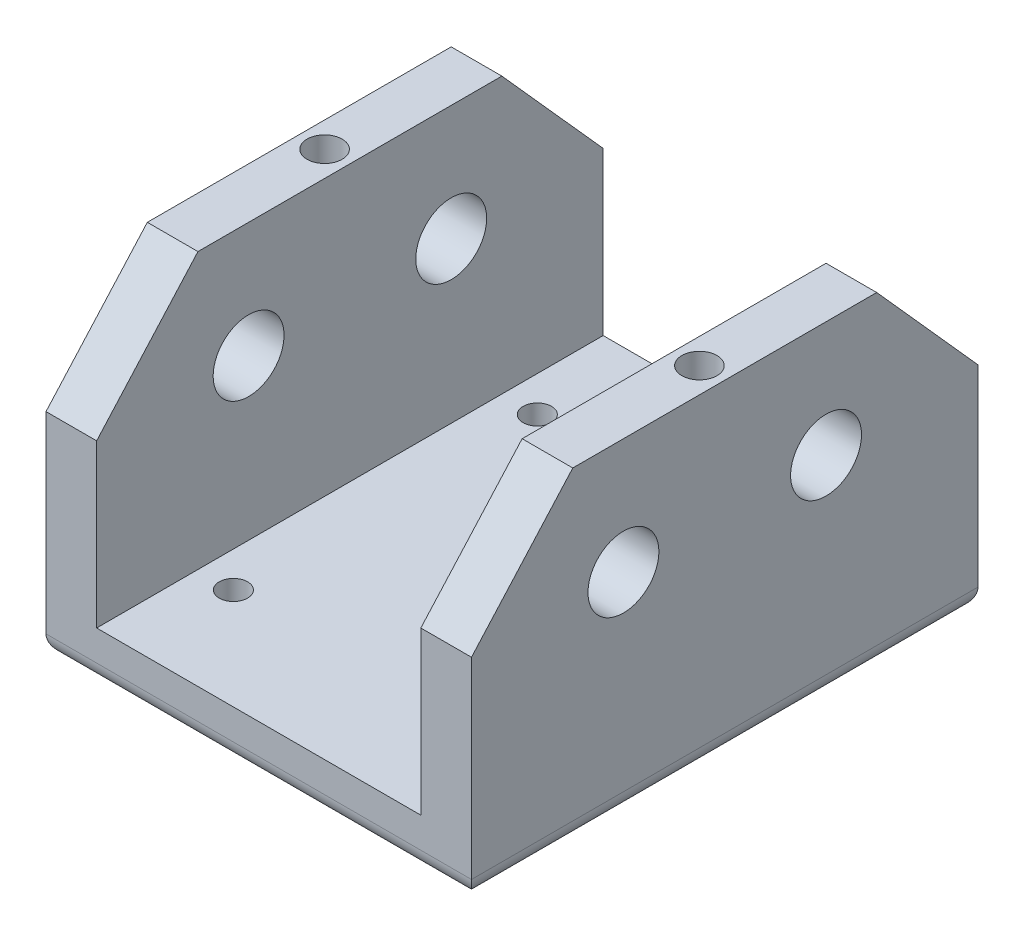
from build123d import *

# Parameters (mm, degrees)
SKETCH1_W           = 63.5
SKETCH1_H           = 6.35
BOSS_EXTRUDE1_DEPTH = 53.34
BOSS_EXTRUDE2_DEPTH = 6.35
CUT_EXTRUDE1_REACH  = 94.454
SKETCH11_R          = 4.445
FILLET1_R           = 2.54
CUT_EXTRUDE2_REACH  = 94.454
SKETCH19_R          = 1.778
SKETCH20_R          = 2.2
CUT_EXTRUDE3_DEPTH  = 4.9


with BuildPart() as part:
    # Sketch1 → Boss-Extrude1 (new body)
    with BuildSketch(Plane(origin=(0, 0, 0), x_dir=(0, 0, -1), z_dir=(1, 0, 0))):
        with Locations((31.75, 3.175)):
            Rectangle(SKETCH1_W, SKETCH1_H)
    extrude(amount=-BOSS_EXTRUDE1_DEPTH)

    # Sketch2 → Boss-Extrude2 (add)
    with BuildSketch(Plane(origin=(0, 0, 0), x_dir=(0, 0, -1), z_dir=(1, 0, 0))):
        Polygon((0, 6.35), (0, 26.67), (12.7, 40.869031657), (50.8, 40.869031657), (63.5, 26.67), (63.5, 6.35), align=None)
    boss_extrude2 = extrude(amount=-BOSS_EXTRUDE2_DEPTH)

    # Sketch11 → Cut-Extrude1 (cut, up to next)
    with BuildSketch(Plane(origin=(0, 0, 0), x_dir=(0, 0, -1), z_dir=(1, 0, 0)), mode=Mode.PRIVATE) as cut_extrude1_sk1:
        with Locations((19.05, 26.391031657)):
            Circle(SKETCH11_R)
    cut_extrude1_tool1 = extrude(cut_extrude1_sk1.sketch, amount=-CUT_EXTRUDE1_REACH, mode=Mode.PRIVATE) & part.part
    # Sketch11 → Cut-Extrude1 (cut, up to next)
    with BuildSketch(Plane(origin=(0, 0, 0), x_dir=(0, 0, -1), z_dir=(1, 0, 0)), mode=Mode.PRIVATE) as cut_extrude1_sk2:
        with Locations((44.45, 26.391031657)):
            Circle(SKETCH11_R)
    cut_extrude1_tool2 = extrude(cut_extrude1_sk2.sketch, amount=-CUT_EXTRUDE1_REACH, mode=Mode.PRIVATE) & part.part
    cut_extrude1_1 = cut_extrude1_tool1.solids().sort_by_distance((0, 26.391032, -19.05))[0]
    add(cut_extrude1_1, mode=Mode.SUBTRACT)
    cut_extrude1_2 = cut_extrude1_tool2.solids().sort_by_distance((0, 26.391032, -44.45))[0]
    add(cut_extrude1_2, mode=Mode.SUBTRACT)
    cut_extrude1 = cut_extrude1_1 + cut_extrude1_2  # Cut-Extrude1 as one shape, for the pattern or mirror that repeats it

    # Fillet1
    fillet1_edges = [part.edges().sort_by_distance(p)[0] for p in [
        (0, 0, -31.75),
        (-26.67, 0, -63.5),
        (-53.34, 0, -31.75),
        (-26.67, 0, 0),
    ]]
    fillet(fillet1_edges, radius=FILLET1_R)

    # Sketch19 → Cut-Extrude2 (cut, up to next)
    with BuildSketch(Plane.XZ, mode=Mode.PRIVATE) as cut_extrude2_sk1:
        with Locations((-10.795, -50.8)):
            Circle(SKETCH19_R)
    cut_extrude2_tool1 = extrude(cut_extrude2_sk1.sketch, amount=-CUT_EXTRUDE2_REACH, mode=Mode.PRIVATE) & part.part
    # Sketch19 → Cut-Extrude2 (cut, up to next)
    with BuildSketch(Plane.XZ, mode=Mode.PRIVATE) as cut_extrude2_sk2:
        with Locations((-42.545, -50.8)):
            Circle(SKETCH19_R)
    cut_extrude2_tool2 = extrude(cut_extrude2_sk2.sketch, amount=-CUT_EXTRUDE2_REACH, mode=Mode.PRIVATE) & part.part
    # Sketch19 → Cut-Extrude2 (cut, up to next)
    with BuildSketch(Plane.XZ, mode=Mode.PRIVATE) as cut_extrude2_sk3:
        with Locations((-42.545, -12.7)):
            Circle(SKETCH19_R)
    cut_extrude2_tool3 = extrude(cut_extrude2_sk3.sketch, amount=-CUT_EXTRUDE2_REACH, mode=Mode.PRIVATE) & part.part
    # Sketch19 → Cut-Extrude2 (cut, up to next)
    with BuildSketch(Plane.XZ, mode=Mode.PRIVATE) as cut_extrude2_sk4:
        with Locations((-10.795, -12.7)):
            Circle(SKETCH19_R)
    cut_extrude2_tool4 = extrude(cut_extrude2_sk4.sketch, amount=-CUT_EXTRUDE2_REACH, mode=Mode.PRIVATE) & part.part
    add(cut_extrude2_tool1.solids().sort_by_distance((-10.795, 0, -50.8))[0], mode=Mode.SUBTRACT)
    add(cut_extrude2_tool2.solids().sort_by_distance((-42.545, 0, -50.8))[0], mode=Mode.SUBTRACT)
    add(cut_extrude2_tool3.solids().sort_by_distance((-42.545, 0, -12.7))[0], mode=Mode.SUBTRACT)
    add(cut_extrude2_tool4.solids().sort_by_distance((-10.795, 0, -12.7))[0], mode=Mode.SUBTRACT)

    # Mirror1: Boss-Extrude2, Cut-Extrude1 across plane
    add(boss_extrude2.mirror(Plane(origin=(-26.67, 0, 0), x_dir=(0, 0, 1), z_dir=(1, 0, 0))))
    add(cut_extrude1.mirror(Plane(origin=(-26.67, 0, 0), x_dir=(0, 0, 1), z_dir=(1, 0, 0))), mode=Mode.SUBTRACT)

    # Sketch20 → Cut-Extrude3 (cut)
    with BuildSketch(Plane(origin=(0, 40.869031657, 0), x_dir=(1, 0, 0), z_dir=(0, 1, 0))):
        with Locations((-50.165, 31.75)):
            Circle(SKETCH20_R)
        with Locations((-3.175, 31.75)):
            Circle(SKETCH20_R)
    extrude(amount=-CUT_EXTRUDE3_DEPTH, mode=Mode.SUBTRACT)


solid = part.part
